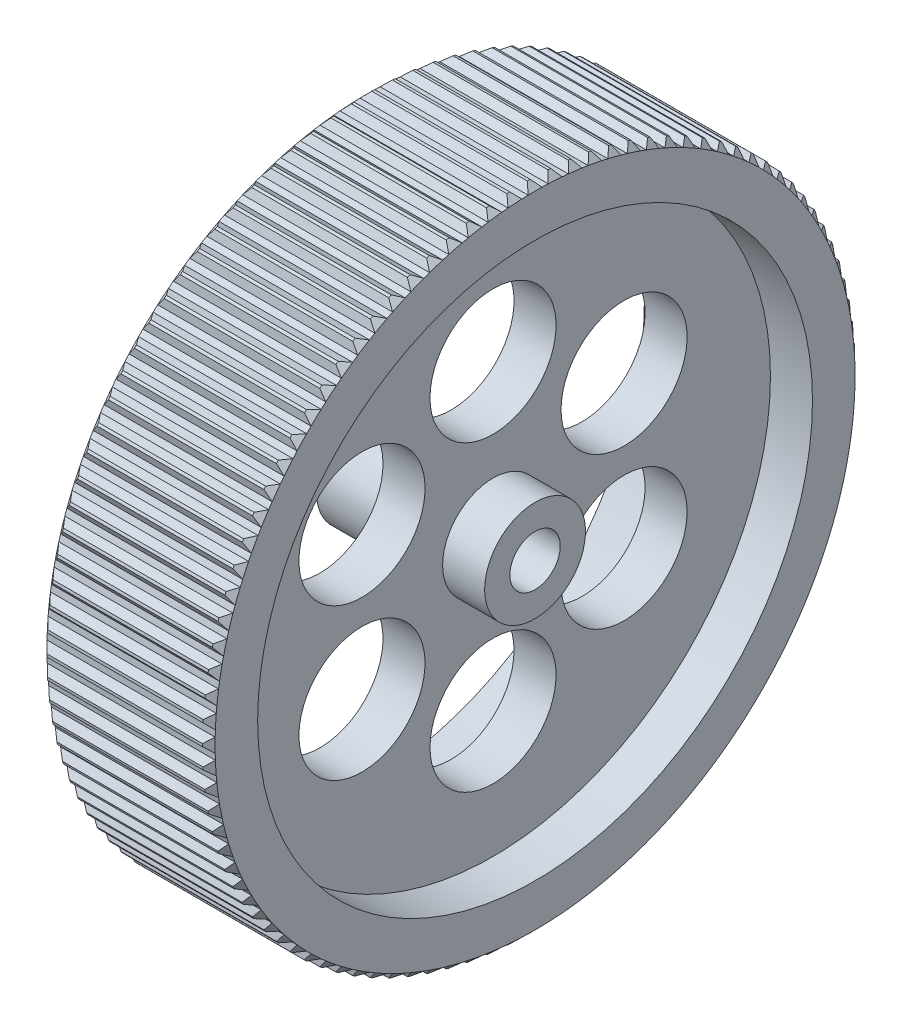
from build123d import *

# Parameters (mm, degrees)
SKETCH2_R               = 7.5
CUT_EXTRUDE1_DEPTH      = 10
CIRPATTERN2_COUNT       = 6
BOSS_EXTRUDE1_DEPTH     = 20
CUT_EXTRUDE2_DEPTH      = 59.668560575
CUT_EXTRUDE2_DEPTH_BACK = 59.668560575
SKETCH5_R               = 76.326407244
SKETCH5_R_2             = 38.810257356
SKETCH8_R               = 38.059904348
SKETCH8_R_2             = 35.757076036
BOSS_EXTRUDE2_DEPTH     = 20


with BuildPart() as part:
    # Sketch1 → Revolve1 (revolve)
    with BuildSketch(Plane.XY, mode=Mode.PRIVATE) as revolve1_sk:
        Polygon((-0.348622639, 6), (-0.348622639, 33), (-10.348622639, 33), (-10.348622639, 38), (9.651377361, 38), (9.651377361, 33), (4.651377361, 33), (4.651377361, 6), (9.651377361, 6), (9.651377361, 3), (-10.348622639, 3), (-10.348622639, 6), align=None)
    revolve(revolve1_sk.sketch.rotate(Axis((-38.059968901, 0, 0), (1, 0, 0)), 90), axis=Axis((-38.059968901, 0, 0), (1, 0, 0)))

    # Sketch2 → Cut-Extrude1 (cut)
    with BuildSketch(Plane.ZY.offset(0.348622639)):
        with Locations((0, 18)):
            Circle(SKETCH2_R)
    cut_extrude1 = extrude(amount=-CUT_EXTRUDE1_DEPTH, mode=Mode.SUBTRACT)

    # CirPattern2: Cut-Extrude1 ×6 about axis
    cirpattern2_axis = Axis((0, 0, 0), (1, 0, 0))
    for i in range(1, CIRPATTERN2_COUNT):
        add(cut_extrude1.rotate(cirpattern2_axis, i * 360 / CIRPATTERN2_COUNT), mode=Mode.SUBTRACT)

    # Sketch3 → Boss-Extrude1 (add)
    with BuildSketch(Plane.ZY.offset(10.348622639)):
        Polygon((-0.8796455, 37.98981737), (0, 39), (0.8796455, 37.98981737), (0, 35.982617944), align=None)
        Polygon((-3.26331009, 37.859619745), (-2.448830262, 38.923042409), (-1.507490649, 37.970086541), (-2.259367275, 35.911614467), align=None)
        Polygon((-5.634095886, 37.580007498), (-4.887996109, 38.692473351), (-3.888677421, 37.800505128), (-4.509817859, 35.698884254), align=None)
        Polygon((-7.982646479, 37.15208413), (-7.307871269, 38.309202778), (-6.25451736, 37.48174239), (-6.742470253, 35.345266854), align=None)
        Polygon((-10.299693214, 36.577538459), (-9.698905599, 37.774743284), (-8.595673576, 37.015056339), (-8.948513196, 34.852157834), align=None)
        Polygon((-12.576091765, 35.858637954), (-12.051662781, 37.091204136), (-10.902906596, 36.402288771), (-11.119240447, 34.221503269), align=None)
        Polygon((-14.802858228, 34.998219787), (-14.356857555, 36.26128295), (-13.167110824, 35.645858), (-13.246085135, 33.455792065), align=None)
        Polygon((-16.971204571, 33.999679637), (-16.605392371, 35.288255046), (-15.379350481, 34.748749312), (-15.320653577, 32.558046134), align=None)
        Polygon((-19.072573324, 32.866958283), (-18.78839329, 34.175960522), (-17.530894869, 33.714503186), (-17.334758398, 31.53180847), align=None)
        Polygon((-21.098671343, 31.604526061), (-20.897245004, 32.928789095), (-19.613252823, 32.547201319), (-19.280450848, 30.381129163), align=None)
        Polygon((-23.041502546, 30.217365213), (-22.923624839, 31.551662781), (-21.618206229, 31.251450518), (-21.150052166, 29.110549419), align=None)
        Polygon((-24.893399464, 28.71095023), (-24.8595356, 30.050016468), (-23.537842451, 29.832364518), (-22.936183892, 27.725083636), align=None)
        Polygon((-26.647053508, 27.091226243), (-26.697337131, 28.429776469), (-25.364585563, 28.295543805), (-24.631796977, 26.230199614), align=None)
        Polygon((-28.295543805, 25.364585563), (-28.429776469, 26.697337131), (-27.091226243, 26.647053508), (-26.230199614, 24.631796977), align=None)
        Polygon((-29.832364518, 23.537842451), (-30.050016468, 24.8595356), (-28.71095023, 24.893399464), (-27.725083636, 22.936183892), align=None)
        Polygon((-31.251450518, 21.618206229), (-31.551662781, 22.923624839), (-30.217365213, 23.041502546), (-29.110549419, 21.150052166), align=None)
        Polygon((-32.547201319, 19.613252823), (-32.928789095, 20.897245004), (-31.604526061, 21.098671343), (-30.381129163, 19.280450848), align=None)
        Polygon((-33.714503186, 17.530894869), (-34.175960522, 18.78839329), (-32.866958283, 19.072573324), (-31.53180847, 17.334758398), align=None)
        Polygon((-34.748749312, 15.379350481), (-35.288255046, 16.605392371), (-33.999679637, 16.971204571), (-32.558046134, 15.320653577), align=None)
        Polygon((-35.645858, 13.167110824), (-36.26128295, 14.356857555), (-34.998219787, 14.802858228), (-33.455792065, 13.246085135), align=None)
        Polygon((-36.402288771, 10.902906596), (-37.091204136, 12.051662781), (-35.858637954, 12.576091765), (-34.221503269, 11.119240447), align=None)
        Polygon((-37.015056339, 8.595673576), (-37.774743284, 9.698905599), (-36.577538459, 10.299693214), (-34.852157834, 8.948513196), align=None)
        Polygon((-37.48174239, 6.25451736), (-38.309202778, 7.307871269), (-37.15208413, 7.982646479), (-35.345266854, 6.742470253), align=None)
        Polygon((-37.800505128, 3.888677421), (-38.692473351, 4.887996109), (-37.580007498, 5.634095886), (-35.698884254, 4.509817859), align=None)
        Polygon((-37.970086541, 1.507490649), (-38.923042409, 2.448830262), (-37.859619745, 3.26331009), (-35.911614467, 2.259367275), align=None)
        Polygon((-37.98981737, -0.8796455), (-39, 0), (-37.98981737, 0.8796455), (-35.982617944, 0), align=None)
        Polygon((-37.859619745, -3.26331009), (-38.923042409, -2.448830262), (-37.970086541, -1.507490649), (-35.911614467, -2.259367275), align=None)
        Polygon((-37.580007498, -5.634095886), (-38.692473351, -4.887996109), (-37.800505128, -3.888677421), (-35.698884254, -4.509817859), align=None)
        Polygon((-37.15208413, -7.982646479), (-38.309202778, -7.307871269), (-37.48174239, -6.25451736), (-35.345266854, -6.742470253), align=None)
        Polygon((-36.577538459, -10.299693214), (-37.774743284, -9.698905599), (-37.015056339, -8.595673576), (-34.852157834, -8.948513196), align=None)
        Polygon((-35.858637954, -12.576091765), (-37.091204136, -12.051662781), (-36.402288771, -10.902906596), (-34.221503269, -11.119240447), align=None)
        Polygon((-34.998219787, -14.802858228), (-36.26128295, -14.356857555), (-35.645858, -13.167110824), (-33.455792065, -13.246085135), align=None)
        Polygon((-33.999679637, -16.971204571), (-35.288255046, -16.605392371), (-34.748749312, -15.379350481), (-32.558046134, -15.320653577), align=None)
        Polygon((-32.866958283, -19.072573324), (-34.175960522, -18.78839329), (-33.714503186, -17.530894869), (-31.53180847, -17.334758398), align=None)
        Polygon((-31.604526061, -21.098671343), (-32.928789095, -20.897245004), (-32.547201319, -19.613252823), (-30.381129163, -19.280450848), align=None)
        Polygon((-30.217365213, -23.041502546), (-31.551662781, -22.923624839), (-31.251450518, -21.618206229), (-29.110549419, -21.150052166), align=None)
        Polygon((-28.71095023, -24.893399464), (-30.050016468, -24.8595356), (-29.832364518, -23.537842451), (-27.725083636, -22.936183892), align=None)
        Polygon((-27.091226243, -26.647053508), (-28.429776469, -26.697337131), (-28.295543805, -25.364585563), (-26.230199614, -24.631796977), align=None)
        Polygon((-25.364585563, -28.295543805), (-26.697337131, -28.429776469), (-26.647053508, -27.091226243), (-24.631796977, -26.230199614), align=None)
        Polygon((-23.537842451, -29.832364518), (-24.8595356, -30.050016468), (-24.893399464, -28.71095023), (-22.936183892, -27.725083636), align=None)
        Polygon((-21.618206229, -31.251450518), (-22.923624839, -31.551662781), (-23.041502546, -30.217365213), (-21.150052166, -29.110549419), align=None)
        Polygon((-19.613252823, -32.547201319), (-20.897245004, -32.928789095), (-21.098671343, -31.604526061), (-19.280450848, -30.381129163), align=None)
        Polygon((-17.530894869, -33.714503186), (-18.78839329, -34.175960522), (-19.072573324, -32.866958283), (-17.334758398, -31.53180847), align=None)
        Polygon((-15.379350481, -34.748749312), (-16.605392371, -35.288255046), (-16.971204571, -33.999679637), (-15.320653577, -32.558046134), align=None)
        Polygon((-13.167110824, -35.645858), (-14.356857555, -36.26128295), (-14.802858228, -34.998219787), (-13.246085135, -33.455792065), align=None)
        Polygon((-10.902906596, -36.402288771), (-12.051662781, -37.091204136), (-12.576091765, -35.858637954), (-11.119240447, -34.221503269), align=None)
        Polygon((-8.595673576, -37.015056339), (-9.698905599, -37.774743284), (-10.299693214, -36.577538459), (-8.948513196, -34.852157834), align=None)
        Polygon((-6.25451736, -37.48174239), (-7.307871269, -38.309202778), (-7.982646479, -37.15208413), (-6.742470253, -35.345266854), align=None)
        Polygon((-3.888677421, -37.800505128), (-4.887996109, -38.692473351), (-5.634095886, -37.580007498), (-4.509817859, -35.698884254), align=None)
        Polygon((-1.507490649, -37.970086541), (-2.448830262, -38.923042409), (-3.26331009, -37.859619745), (-2.259367275, -35.911614467), align=None)
        Polygon((0.8796455, -37.98981737), (0, -39), (-0.8796455, -37.98981737), (0, -35.982617944), align=None)
        Polygon((3.26331009, -37.859619745), (2.448830262, -38.923042409), (1.507490649, -37.970086541), (2.259367275, -35.911614467), align=None)
        Polygon((5.634095886, -37.580007498), (4.887996109, -38.692473351), (3.888677421, -37.800505128), (4.509817859, -35.698884254), align=None)
        Polygon((7.982646479, -37.15208413), (7.307871269, -38.309202778), (6.25451736, -37.48174239), (6.742470253, -35.345266854), align=None)
        Polygon((10.299693214, -36.577538459), (9.698905599, -37.774743284), (8.595673576, -37.015056339), (8.948513196, -34.852157834), align=None)
        Polygon((12.576091765, -35.858637954), (12.051662781, -37.091204136), (10.902906596, -36.402288771), (11.119240447, -34.221503269), align=None)
        Polygon((14.802858228, -34.998219787), (14.356857555, -36.26128295), (13.167110824, -35.645858), (13.246085135, -33.455792065), align=None)
        Polygon((16.971204571, -33.999679637), (16.605392371, -35.288255046), (15.379350481, -34.748749312), (15.320653577, -32.558046134), align=None)
        Polygon((19.072573324, -32.866958283), (18.78839329, -34.175960522), (17.530894869, -33.714503186), (17.334758398, -31.53180847), align=None)
        Polygon((21.098671343, -31.604526061), (20.897245004, -32.928789095), (19.613252823, -32.547201319), (19.280450848, -30.381129163), align=None)
        Polygon((23.041502546, -30.217365213), (22.923624839, -31.551662781), (21.618206229, -31.251450518), (21.150052166, -29.110549419), align=None)
        Polygon((24.893399464, -28.71095023), (24.8595356, -30.050016468), (23.537842451, -29.832364518), (22.936183892, -27.725083636), align=None)
        Polygon((26.647053508, -27.091226243), (26.697337131, -28.429776469), (25.364585563, -28.295543805), (24.631796977, -26.230199614), align=None)
        Polygon((28.295543805, -25.364585563), (28.429776469, -26.697337131), (27.091226243, -26.647053508), (26.230199614, -24.631796977), align=None)
        Polygon((29.832364518, -23.537842451), (30.050016468, -24.8595356), (28.71095023, -24.893399464), (27.725083636, -22.936183892), align=None)
        Polygon((31.251450518, -21.618206229), (31.551662781, -22.923624839), (30.217365213, -23.041502546), (29.110549419, -21.150052166), align=None)
        Polygon((32.547201319, -19.613252823), (32.928789095, -20.897245004), (31.604526061, -21.098671343), (30.381129163, -19.280450848), align=None)
        Polygon((33.714503186, -17.530894869), (34.175960522, -18.78839329), (32.866958283, -19.072573324), (31.53180847, -17.334758398), align=None)
        Polygon((34.748749312, -15.379350481), (35.288255046, -16.605392371), (33.999679637, -16.971204571), (32.558046134, -15.320653577), align=None)
        Polygon((35.645858, -13.167110824), (36.26128295, -14.356857555), (34.998219787, -14.802858228), (33.455792065, -13.246085135), align=None)
        Polygon((36.402288771, -10.902906596), (37.091204136, -12.051662781), (35.858637954, -12.576091765), (34.221503269, -11.119240447), align=None)
        Polygon((37.015056339, -8.595673576), (37.774743284, -9.698905599), (36.577538459, -10.299693214), (34.852157834, -8.948513196), align=None)
        Polygon((37.48174239, -6.25451736), (38.309202778, -7.307871269), (37.15208413, -7.982646479), (35.345266854, -6.742470253), align=None)
        Polygon((37.800505128, -3.888677421), (38.692473351, -4.887996109), (37.580007498, -5.634095886), (35.698884254, -4.509817859), align=None)
        Polygon((37.970086541, -1.507490649), (38.923042409, -2.448830262), (37.859619745, -3.26331009), (35.911614467, -2.259367275), align=None)
        Polygon((37.98981737, 0.8796455), (39, 0), (37.98981737, -0.8796455), (35.982617944, 0), align=None)
        Polygon((37.859619745, 3.26331009), (38.923042409, 2.448830262), (37.970086541, 1.507490649), (35.911614467, 2.259367275), align=None)
        Polygon((37.580007498, 5.634095886), (38.692473351, 4.887996109), (37.800505128, 3.888677421), (35.698884254, 4.509817859), align=None)
        Polygon((37.15208413, 7.982646479), (38.309202778, 7.307871269), (37.48174239, 6.25451736), (35.345266854, 6.742470253), align=None)
        Polygon((36.577538459, 10.299693214), (37.774743284, 9.698905599), (37.015056339, 8.595673576), (34.852157834, 8.948513196), align=None)
        Polygon((35.858637954, 12.576091765), (37.091204136, 12.051662781), (36.402288771, 10.902906596), (34.221503269, 11.119240447), align=None)
        Polygon((34.998219787, 14.802858228), (36.26128295, 14.356857555), (35.645858, 13.167110824), (33.455792065, 13.246085135), align=None)
        Polygon((33.999679637, 16.971204571), (35.288255046, 16.605392371), (34.748749312, 15.379350481), (32.558046134, 15.320653577), align=None)
        Polygon((32.866958283, 19.072573324), (34.175960522, 18.78839329), (33.714503186, 17.530894869), (31.53180847, 17.334758398), align=None)
        Polygon((31.604526061, 21.098671343), (32.928789095, 20.897245004), (32.547201319, 19.613252823), (30.381129163, 19.280450848), align=None)
        Polygon((30.217365213, 23.041502546), (31.551662781, 22.923624839), (31.251450518, 21.618206229), (29.110549419, 21.150052166), align=None)
        Polygon((28.71095023, 24.893399464), (30.050016468, 24.8595356), (29.832364518, 23.537842451), (27.725083636, 22.936183892), align=None)
        Polygon((27.091226243, 26.647053508), (28.429776469, 26.697337131), (28.295543805, 25.364585563), (26.230199614, 24.631796977), align=None)
        Polygon((25.364585563, 28.295543805), (26.697337131, 28.429776469), (26.647053508, 27.091226243), (24.631796977, 26.230199614), align=None)
        Polygon((23.537842451, 29.832364518), (24.8595356, 30.050016468), (24.893399464, 28.71095023), (22.936183892, 27.725083636), align=None)
        Polygon((21.618206229, 31.251450518), (22.923624839, 31.551662781), (23.041502546, 30.217365213), (21.150052166, 29.110549419), align=None)
        Polygon((19.613252823, 32.547201319), (20.897245004, 32.928789095), (21.098671343, 31.604526061), (19.280450848, 30.381129163), align=None)
        Polygon((17.530894869, 33.714503186), (18.78839329, 34.175960522), (19.072573324, 32.866958283), (17.334758398, 31.53180847), align=None)
        Polygon((15.379350481, 34.748749312), (16.605392371, 35.288255046), (16.971204571, 33.999679637), (15.320653577, 32.558046134), align=None)
        Polygon((13.167110824, 35.645858), (14.356857555, 36.26128295), (14.802858228, 34.998219787), (13.246085135, 33.455792065), align=None)
        Polygon((10.902906596, 36.402288771), (12.051662781, 37.091204136), (12.576091765, 35.858637954), (11.119240447, 34.221503269), align=None)
        Polygon((8.595673576, 37.015056339), (9.698905599, 37.774743284), (10.299693214, 36.577538459), (8.948513196, 34.852157834), align=None)
        Polygon((6.25451736, 37.48174239), (7.307871269, 38.309202778), (7.982646479, 37.15208413), (6.742470253, 35.345266854), align=None)
        Polygon((3.888677421, 37.800505128), (4.887996109, 38.692473351), (5.634095886, 37.580007498), (4.509817859, 35.698884254), align=None)
        Polygon((1.507490649, 37.970086541), (2.448830262, 38.923042409), (3.26331009, 37.859619745), (2.259367275, 35.911614467), align=None)
    extrude(amount=-BOSS_EXTRUDE1_DEPTH)

    # Sketch5 → Cut-Extrude2 (cut, two sides: drawn at the far end of the back side and taken through both)
    with BuildSketch(Plane(origin=(9.651377361, 0, 0), x_dir=(0, 0, -1), z_dir=(1, 0, 0)).offset(-CUT_EXTRUDE2_DEPTH_BACK)):
        Circle(SKETCH5_R)
        Circle(SKETCH5_R_2, mode=Mode.SUBTRACT)
    extrude(amount=CUT_EXTRUDE2_DEPTH + CUT_EXTRUDE2_DEPTH_BACK, mode=Mode.SUBTRACT)

    # Sketch7 → Cut-Revolve1 (revolve, cut)
    with BuildSketch(Plane(origin=(0, 0, 0), x_dir=(1, 0, 0), z_dir=(0, 1, 0))):
        Polygon((-9.598622639, 38.809904348), (8.901377361, 38.809904348), (9.651377361, 38.059904348), (9.651377361, 0), (26.319493701, 0), (26.319493701, 56.78361749), (-20.737929704, 56.78361749), (-20.737929704, 0), (-10.348622639, 0), (-10.348622639, 38.059904348), align=None)
    revolve(axis=Axis((-10.348622639, 0, 0), (1, 0, 0)), mode=Mode.SUBTRACT)

    # Sketch8 → Boss-Extrude2 (add)
    with BuildSketch(Plane.ZY.offset(10.348622639)):
        Circle(SKETCH8_R)
        Circle(SKETCH8_R_2, mode=Mode.SUBTRACT)
    extrude(amount=-BOSS_EXTRUDE2_DEPTH)


solid = part.part
